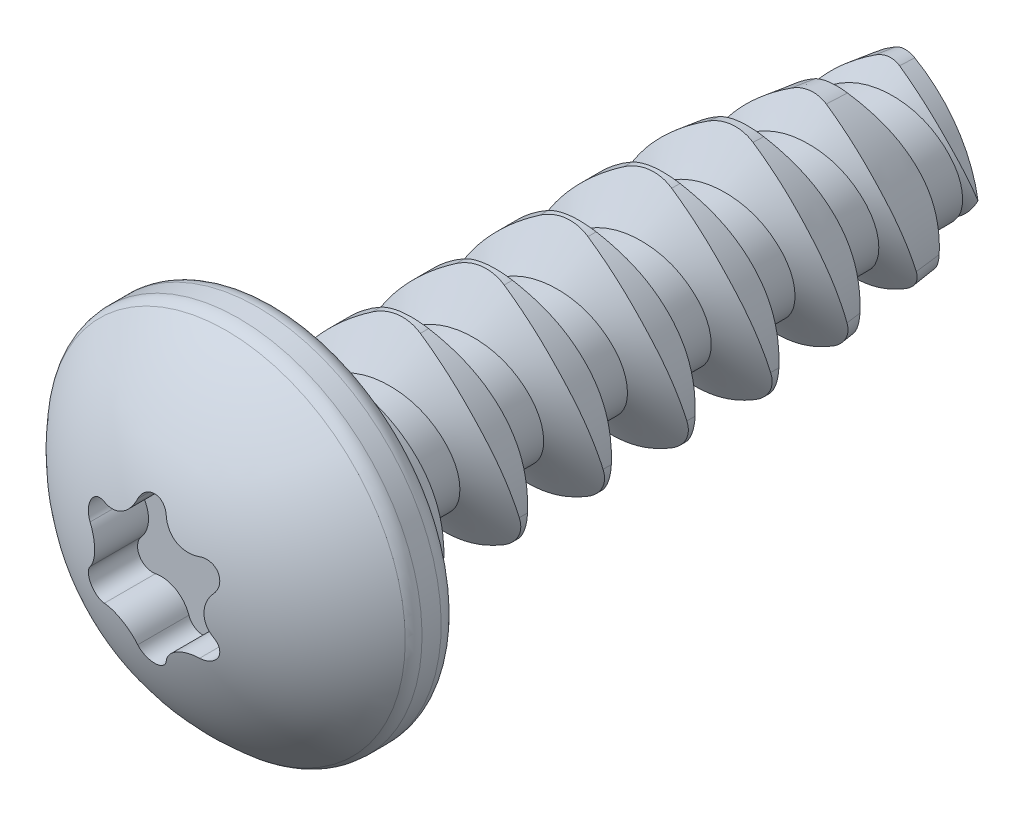
from build123d import *

# Parameters (mm, degrees)
SKETCH2_W          = 9.525
SKETCH2_H          = 1.6129
CUT_SWEEP2_PITCH   = 1.27
SKETCH1_OUTSIDE_W  = 7.338
SKETCH1_OUTSIDE_H  = 7.338
CUT_EXTRUDE2_DEPTH = 10.794311196
SKETCH6_OUTSIDE_W  = 9.006
SKETCH6_OUTSIDE_H  = 9.006
CUT_EXTRUDE4_DEPTH = 7.974915741
CUT_EXTRUDE4_DRAFT = -7
CUT_EXTRUDE5_DEPTH = 0.9144
CIRPATTERN1_COUNT  = 6


with BuildPart() as part:
    # Sketch2 → Revolve1 (revolve)
    with BuildSketch(Plane(origin=(0, 0, 0), x_dir=(0, 0, -1), z_dir=(1, 0, 0)), mode=Mode.PRIVATE) as revolve1_sk:
        with Locations((0, 0.80645)):
            Rectangle(SKETCH2_W, SKETCH2_H)
    revolve(revolve1_sk.sketch.rotate(Axis((0, 0, -4.7625), (0, 0, -1)), 90), axis=Axis((0, 0, -4.7625), (0, 0, -1)))

    # Cut-Sweep2: arcs per turn and ends read off the stored shape
    # Cut-Sweep2: the profile of Sketch3 profile screwed along a right-hand helix through 11 turns, 8 arcs to a turn; built about Z, then put on its axis
    cut_sweep2_z = Axis((0, 0, 0), (0, 0, 1))
    cut_sweep2_corners = [(1.6132, 0, -1.269826795), (1.6132, 0, -2.476673205), (0.96774, 0, -2.1040167), (0.96774, 0, -1.6424833)]
    with BuildLine(mode=Mode.PRIVATE) as cut_sweep2_profile:
        Line(cut_sweep2_corners[0], cut_sweep2_corners[1])
        Line(cut_sweep2_corners[1], cut_sweep2_corners[2])
        Line(cut_sweep2_corners[2], cut_sweep2_corners[3])
        Line(cut_sweep2_corners[3], cut_sweep2_corners[0])
    cut_sweep2_cap = Face(cut_sweep2_profile.wire())
    cut_sweep2_turn_angles = [0, 22.5, 45, 67.5, 90, 112.5, 135, 157.5, 180, 202.5, 225, 247.5, 270, 292.5, 315, 337.5, 360]
    cut_sweep2_turn_weights = [1, 0.9238795325112867, 1, 0.9238795325112867, 1, 0.9238795325112867, 1, 0.9238795325112867, 1, 0.9238795325112867, 1, 0.9238795325112867, 1, 0.9238795325112867, 1, 0.9238795325112867, 1]
    cut_sweep2_turn_rails = [Edge.make_bspline([Vector(p[0], p[1], 0).rotate(cut_sweep2_z, cut_sweep2_turn_angles[k]) / cut_sweep2_turn_weights[k] + Vector(0, 0, p[2] + CUT_SWEEP2_PITCH * cut_sweep2_turn_angles[k] / 360) for k in range(17)], [0, 0, 0, 1, 1, 2, 2, 3, 3, 4, 4, 5, 5, 6, 6, 7, 7, 8, 8, 8], 2, cut_sweep2_turn_weights) for p in cut_sweep2_corners]
    cut_sweep2_turn_sides = [Face.make_surface_from_curves(cut_sweep2_turn_rails[p[0]], cut_sweep2_turn_rails[p[1]]) for p in [(0, 1), (1, 2), (2, 3), (3, 0)]]
    cut_sweep2 = Plane(origin=(0, 0, -4.7625), x_dir=(0, 1, 0), z_dir=(0, 0, 1)) * Solid(Shell([*[p.moved(Location((0, 0, CUT_SWEEP2_PITCH * i))) for i in range(11) for p in cut_sweep2_turn_sides], cut_sweep2_cap, cut_sweep2_cap.rotate(cut_sweep2_z, 3960).moved(Location((0, 0, CUT_SWEEP2_PITCH * 3960 / 360)))]))
    add(cut_sweep2, mode=Mode.SUBTRACT)

    # Sketch1 outside → Cut-Extrude2 (cut, through all)
    with BuildSketch(Plane.XY.offset(4.7625)):
        Rectangle(SKETCH1_OUTSIDE_W, SKETCH1_OUTSIDE_H)
        with BuildLine():
            ThreePointArc((0.323002686, 1.526220698), (0, 1.6129), (-0.323002686, 1.526220698))
            ThreePointArc((-0.323002686, 1.526220698), (-1.171953237, 0.676627517), (-1.48324724, -0.483381818))
            ThreePointArc((-1.48324724, -0.483381818), (-1.396812374, -0.80645), (-1.160244554, -1.042838881))
            ThreePointArc((-1.160244554, -1.042838881), (0, -1.353255034), (1.160244554, -1.042838881))
            ThreePointArc((1.160244554, -1.042838881), (1.396812374, -0.80645), (1.48324724, -0.483381818))
            ThreePointArc((1.48324724, -0.483381818), (1.171953237, 0.676627517), (0.323002686, 1.526220698))
        make_face(mode=Mode.SUBTRACT)
    extrude(amount=-CUT_EXTRUDE2_DEPTH, mode=Mode.SUBTRACT)


with BuildPart() as cut_extrude4_tool:
    # Sketch6 outside → Cut-Extrude4 (with draft: the straight prism first)
    with BuildSketch(Plane(origin=(0, 0, -1.85928), x_dir=(-1, 0, 0), z_dir=(0, 0, -1))):
        with Locations((0, 0.13)):
            Rectangle(SKETCH6_OUTSIDE_W, SKETCH6_OUTSIDE_H)
        with BuildLine():
            ThreePointArc((0.323002686, 1.526220698), (0, 1.6129), (-0.323002686, 1.526220698))
            ThreePointArc((-0.323002686, 1.526220698), (-1.171953237, 0.676627517), (-1.48324724, -0.483381818))
            ThreePointArc((-1.48324724, -0.483381818), (-1.396812374, -0.80645), (-1.160244554, -1.042838881))
            ThreePointArc((-1.160244554, -1.042838881), (0, -1.353255034), (1.160244554, -1.042838881))
            ThreePointArc((1.160244554, -1.042838881), (1.396812374, -0.80645), (1.48324724, -0.483381818))
            ThreePointArc((1.48324724, -0.483381818), (1.171953237, 0.676627517), (0.323002686, 1.526220698))
        make_face(mode=Mode.SUBTRACT)
    extrude(amount=CUT_EXTRUDE4_DEPTH)
    # Cut-Extrude4: the draft: its side faces are tilted about the plane it starts from
    cut_extrude4_sides = [cut_extrude4_tool.faces().sort_by_distance(p)[0] for p in [
        (0, -4.373, -5.84673787),
        (-4.503, 0.13, -5.84673787),
        (0, 4.633, -5.84673787),
        (4.503, 0.13, -5.84673787),
        (-1.171953237, 0.676627517, -5.84673787),
        (-1.396812374, -0.80645, -5.84673787),
        (0, -1.353255034, -5.84673787),
        (1.396812374, -0.80645, -5.84673787),
        (1.171953237, 0.676627517, -5.84673787),
        (0, 1.6129, -5.84673787),
    ]]
    draft(cut_extrude4_sides, Plane(origin=(0, 0, -1.85928), x_dir=(-1, 0, 0), z_dir=(0, 0, -1)), CUT_EXTRUDE4_DRAFT)


with BuildPart() as part_1:
    add(part.part)

    # Cut-Extrude4: cut by cut_extrude4_tool
    add(cut_extrude4_tool.part, mode=Mode.SUBTRACT)

    # Sketch7 → Revolve2 (revolve)
    with BuildSketch(Plane(origin=(0, 0, 0), x_dir=(0, 0, -1), z_dir=(1, 0, 0))):
        with BuildLine():
            Line((-4.7625, 0), (-4.7625, 2.491014286))
            ThreePointArc((-4.7625, 2.491014286), (-4.847522717, 2.696277283), (-5.052785714, 2.7813))
            Line((-5.052785714, 2.7813), (-5.343071429, 2.7813))
            ThreePointArc((-5.343071429, 2.7813), (-5.442394225, 2.763779346), (-5.529727452, 2.713332357))
            ThreePointArc((-5.529727452, 2.713332357), (-6.462777013, 1.496815125), (-6.7945, 0))
            Line((-6.7945, 0), (-4.7625, 0))
        make_face()
    revolve(axis=Axis((0, 0, 6.7945), (0, 0, 1)))

    # Sketch8 → Cut-Extrude5 (cut)
    with BuildSketch(Plane.XY.offset(6.7945)):
        with BuildLine():
            Line((-0.414180583, 0.717381814), (0, 0))
            Line((0, 0), (0.414180583, 0.717381814))
            ThreePointArc((0.414180583, 0.717381814), (0.293124331, 0.819930033), (0.215736099, 0.958428462))
            ThreePointArc((0.215736099, 0.958428462), (0, 1.11252), (-0.215736099, 0.958428462))
            ThreePointArc((-0.215736099, 0.958428462), (-0.293124331, 0.819930033), (-0.414180583, 0.717381814))
        make_face()
    cut_extrude5 = extrude(amount=-CUT_EXTRUDE5_DEPTH, mode=Mode.SUBTRACT)

    # CirPattern1: Cut-Extrude5 ×6 about axis
    cirpattern1_axis = Axis((0, 0, 0), (0, 0, 1))
    for i in range(1, CIRPATTERN1_COUNT):
        add(cut_extrude5.rotate(cirpattern1_axis, i * 360 / CIRPATTERN1_COUNT), mode=Mode.SUBTRACT)


solid = part_1.part
